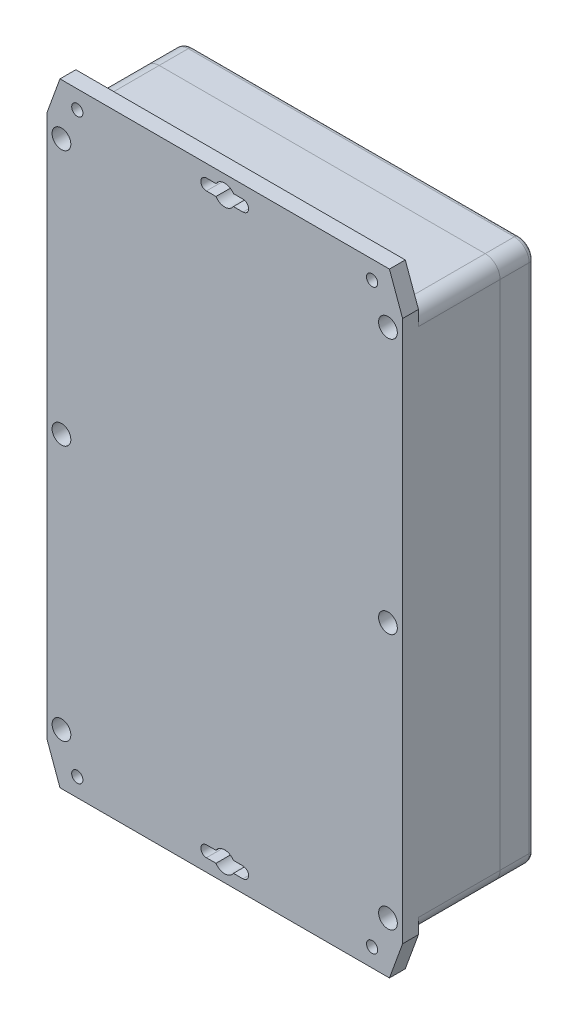
from build123d import *

# Parameters (mm, degrees)
SKETCH2_W               = 146.05
SKETCH2_H               = 251.9934
SKETCH2_R               = 2.2987
BOSS_EXTRUDE1_DEPTH     = 6.5024
CUT_EXTRUDE1_DEPTH      = 146.774141197
BOSS_EXTRUDE2_START     = -33.5026
SKETCH4_W               = 146.05
SKETCH4_H               = 222.25
BOSS_EXTRUDE2_DEPTH     = 33.5026
SKETCH5_R               = 3.8481
CUT_EXTRUDE2_DEPTH      = 24.003
SKETCH6_R               = 2.2225
CUT_EXTRUDE3_DEPTH      = 148.593912628
CUT_EXTRUDE4_DEPTH      = 37.0078
SKETCH9_R               = 3.0099
SKETCH9_R_2             = 1.2446
BOSS_EXTRUDE3_DEPTH     = 7.493
FILLET2_R               = 6.1214
BOSS_EXTRUDE4_DEPTH     = 13.97
CUT_EXTRUDE5_START      = -3.2004
SKETCH12_R              = 3.8481
CUT_EXTRUDE5_DEPTH      = 3.2004
SHELL1_START            = -50.9778
SHELL1_DEPTH            = 10.9728
SHELL1_START_2          = -47.7774
SHELL1_2_DEPTH          = 7.7724
FILLET3_R               = 2.032
SKETCH13_R              = 3.5941
BOSS_EXTRUDE6_DEPTH     = 2.286
BOSS_EXTRUDE6_2_DEPTH   = 2.286
BOSS_EXTRUDE6_3_DEPTH   = 2.286
BOSS_EXTRUDE6_4_DEPTH   = 2.286
BOSS_EXTRUDE6_5_DEPTH   = 2.286
BOSS_EXTRUDE6_6_DEPTH   = 2.286
BOSS_EXTRUDE7_START     = 29.8196
SKETCH14_R              = 2.2225
BOSS_EXTRUDE7_DEPTH     = 29.8196
FILLET4_R               = 1.27
SKETCH15_W              = 1.524
SKETCH15_H              = 222.25
CUT_EXTRUDE_THIN1_DEPTH = 1.524


# Read off the part's stored shape, not the designer's step: Shell1
with BuildPart() as part:
    # Sketch2 → Boss-Extrude1 (new body)
    with BuildSketch(Plane.XY):
        Rectangle(SKETCH2_W, SKETCH2_H)
        with Locations((60.5028, 118.5037)):
            Circle(SKETCH2_R, mode=Mode.SUBTRACT)
        with Locations((-60.5028, 118.5037)):
            Circle(SKETCH2_R, mode=Mode.SUBTRACT)
        with Locations((-60.5028, -118.5037)):
            Circle(SKETCH2_R, mode=Mode.SUBTRACT)
        with Locations((60.5028, -118.5037)):
            Circle(SKETCH2_R, mode=Mode.SUBTRACT)
        with BuildLine():
            Line((-7.5057, -120.8024), (-3.580048681, -120.8024))
            ThreePointArc((-3.580048681, -120.8024), (0, -122.7582), (3.580048681, -120.8024))
            Line((3.580048681, -120.8024), (7.5057, -120.8024))
            ThreePointArc((7.5057, -120.8024), (9.8044, -118.5037), (7.5057, -116.205))
            Line((7.5057, -116.205), (3.580048681, -116.205))
            ThreePointArc((3.580048681, -116.205), (0, -114.2492), (-3.580048681, -116.205))
            Line((-3.580048681, -116.205), (-7.5057, -116.205))
            ThreePointArc((-7.5057, -116.205), (-9.8044, -118.5037), (-7.5057, -120.8024))
        make_face(mode=Mode.SUBTRACT)
        with BuildLine():
            Line((-3.580048681, 120.8024), (-7.5057, 120.8024))
            ThreePointArc((-7.5057, 120.8024), (-9.8044, 118.5037), (-7.5057, 116.205))
            Line((-7.5057, 116.205), (-3.580048681, 116.205))
            ThreePointArc((-3.580048681, 116.205), (0, 114.2492), (3.580048681, 116.205))
            Line((3.580048681, 116.205), (7.5057, 116.205))
            ThreePointArc((7.5057, 116.205), (9.8044, 118.5037), (7.5057, 120.8024))
            Line((7.5057, 120.8024), (3.580048681, 120.8024))
            ThreePointArc((3.580048681, 120.8024), (0, 122.7582), (-3.580048681, 120.8024))
        make_face(mode=Mode.SUBTRACT)
    extrude(amount=-BOSS_EXTRUDE1_DEPTH)

    # Sketch3 → Cut-Extrude1 (cut, through all)
    with BuildSketch(Plane(origin=(0, 0, -6.5024), x_dir=(-1, 0, 0), z_dir=(0, 0, -1))):
        Polygon((73.025, 111.125), (67.612143867, 125.9967), (73.025, 125.9967), align=None)
        Polygon((-73.025, 111.125), (-67.612143867, 125.9967), (-73.025, 125.9967), align=None)
        Polygon((73.025, -111.125), (67.612143867, -125.9967), (73.025, -125.9967), align=None)
        Polygon((-73.025, -111.125), (-67.612143867, -125.9967), (-73.025, -125.9967), align=None)
    extrude(amount=-CUT_EXTRUDE1_DEPTH, mode=Mode.SUBTRACT)

    # Sketch4 → Boss-Extrude2 (add)
    with BuildSketch(Plane.XY.offset(-6.5024).offset(BOSS_EXTRUDE2_START)):
        Rectangle(SKETCH4_W, SKETCH4_H)
    extrude(amount=BOSS_EXTRUDE2_DEPTH)

    # Sketch5 → Cut-Extrude2 (cut)
    with BuildSketch(Plane(origin=(0, 0, 0), x_dir=(-1, 0, 0), z_dir=(0, 0, -1))):
        with Locations((67.0052, 105.0036)):
            Circle(SKETCH5_R)
        with Locations((-67.0052, 105.0036)):
            Circle(SKETCH5_R)
        with Locations((-67.0052, -105.0036)):
            Circle(SKETCH5_R)
        with Locations((67.0052, -105.0036)):
            Circle(SKETCH5_R)
        with Locations((-67.0052, 0)):
            Circle(SKETCH5_R)
        with Locations((67.0052, 0)):
            Circle(SKETCH5_R)
    extrude(amount=CUT_EXTRUDE2_DEPTH, mode=Mode.SUBTRACT)

    # Sketch6 → Cut-Extrude3 (cut, through all)
    with BuildSketch(Plane.XY.offset(-24.003)):
        with Locations((-67.0052, 105.0036)):
            Circle(SKETCH6_R)
        with Locations((67.0052, 105.0036)):
            Circle(SKETCH6_R)
        with Locations((67.0052, -105.0036)):
            Circle(SKETCH6_R)
        with Locations((-67.0052, -105.0036)):
            Circle(SKETCH6_R)
        with Locations((67.0052, 0)):
            Circle(SKETCH6_R)
        with Locations((-67.0052, 0)):
            Circle(SKETCH6_R)
    extrude(amount=-CUT_EXTRUDE3_DEPTH, mode=Mode.SUBTRACT)

    # Sketch8 → Cut-Extrude4 (cut)
    with BuildSketch(Plane(origin=(0, 0, -40.005), x_dir=(-1, 0, 0), z_dir=(0, 0, -1))):
        with BuildLine():
            Line((-67.0052, -6.1214), (-70.485, -6.1214))
            Line((-70.485, -6.1214), (-70.485, -95.4024))
            ThreePointArc((-70.485, -95.4024), (-69.465790177, -97.862990177), (-67.0052, -98.8822))
            Line((-67.0052, -98.8822), (-56.3499, -98.8822))
            ThreePointArc((-56.3499, -98.8822), (-52.919442162, -100.303142162), (-51.4985, -103.7336))
            ThreePointArc((-51.4985, -103.7336), (-50.077557838, -107.164057838), (-46.6471, -108.585))
            Line((-46.6471, -108.585), (46.6471, -108.585))
            ThreePointArc((46.6471, -108.585), (50.077557838, -107.164057838), (51.4985, -103.7336))
            ThreePointArc((51.4985, -103.7336), (52.919442162, -100.303142162), (56.3499, -98.8822))
            Line((56.3499, -98.8822), (67.0052, -98.8822))
            ThreePointArc((67.0052, -98.8822), (69.465790177, -97.862990177), (70.485, -95.4024))
            Line((70.485, -95.4024), (70.485, -6.1214))
            Line((70.485, -6.1214), (67.0052, -6.1214))
            ThreePointArc((67.0052, -6.1214), (60.8838, 0), (67.0052, 6.1214))
            Line((67.0052, 6.1214), (70.485, 6.1214))
            Line((70.485, 6.1214), (70.485, 95.4024))
            ThreePointArc((70.485, 95.4024), (69.465790177, 97.862990177), (67.0052, 98.8822))
            Line((67.0052, 98.8822), (56.3499, 98.8822))
            ThreePointArc((56.3499, 98.8822), (52.919442162, 100.303142162), (51.4985, 103.7336))
            ThreePointArc((51.4985, 103.7336), (50.077557838, 107.164057838), (46.6471, 108.585))
            Line((46.6471, 108.585), (-46.6471, 108.585))
            ThreePointArc((-46.6471, 108.585), (-50.077557838, 107.164057838), (-51.4985, 103.7336))
            ThreePointArc((-51.4985, 103.7336), (-52.919442162, 100.303142162), (-56.3499, 98.8822))
            Line((-56.3499, 98.8822), (-67.0052, 98.8822))
            ThreePointArc((-67.0052, 98.8822), (-69.465790177, 97.862990177), (-70.485, 95.4024))
            Line((-70.485, 95.4024), (-70.485, 6.1214))
            Line((-70.485, 6.1214), (-67.0052, 6.1214))
            ThreePointArc((-67.0052, 6.1214), (-60.8838, 0), (-67.0052, -6.1214))
        make_face()
    extrude(amount=-CUT_EXTRUDE4_DEPTH, mode=Mode.SUBTRACT)

    # Sketch9 → Boss-Extrude3 (add)
    # profile 1 of 8: a face of its own
    with BuildSketch(Plane(origin=(0, 0, 0), x_dir=(-1, 0, 0), z_dir=(0, 0, -1))):
        with Locations(Location((-57.7469, 90.7542, 0), (0, 0, 180))):
            Circle(SKETCH9_R)
        with Locations(Location((-57.7469, 90.7542, 0), (0, 0, 180))):
            Circle(SKETCH9_R_2, mode=Mode.SUBTRACT)
    # profile 2 of 8: a face of its own
    with BuildSketch(Plane(origin=(0, 0, 0), x_dir=(-1, 0, 0), z_dir=(0, 0, -1))):
        with Locations(Location((57.7469, 90.7542, 0), (0, 0, 180))):
            Circle(SKETCH9_R)
        with Locations(Location((57.7469, 90.7542, 0), (0, 0, 180))):
            Circle(SKETCH9_R_2, mode=Mode.SUBTRACT)
    # profile 3 of 8: a face of its own
    with BuildSketch(Plane(origin=(0, 0, 0), x_dir=(-1, 0, 0), z_dir=(0, 0, -1))):
        with Locations(Location((-19.4945, 82.9945, 0), (0, 0, 180))):
            Circle(SKETCH9_R)
        with Locations(Location((-19.4945, 82.9945, 0), (0, 0, 180))):
            Circle(SKETCH9_R_2, mode=Mode.SUBTRACT)
    # profile 4 of 8: a face of its own
    with BuildSketch(Plane(origin=(0, 0, 0), x_dir=(-1, 0, 0), z_dir=(0, 0, -1))):
        with Locations(Location((19.4945, 82.9945, 0), (0, 0, 180))):
            Circle(SKETCH9_R)
        with Locations(Location((19.4945, 82.9945, 0), (0, 0, 180))):
            Circle(SKETCH9_R_2, mode=Mode.SUBTRACT)
    # profile 5 of 8: a face of its own
    with BuildSketch(Plane(origin=(0, 0, 0), x_dir=(-1, 0, 0), z_dir=(0, 0, -1))):
        with Locations(Location((57.7469, -90.7542, 0), (0, 0, 180))):
            Circle(SKETCH9_R)
        with Locations(Location((57.7469, -90.7542, 0), (0, 0, 180))):
            Circle(SKETCH9_R_2, mode=Mode.SUBTRACT)
    # profile 6 of 8: a face of its own
    with BuildSketch(Plane(origin=(0, 0, 0), x_dir=(-1, 0, 0), z_dir=(0, 0, -1))):
        with Locations(Location((-19.4945, -82.9945, 0), (0, 0, 180))):
            Circle(SKETCH9_R)
        with Locations(Location((-19.4945, -82.9945, 0), (0, 0, 180))):
            Circle(SKETCH9_R_2, mode=Mode.SUBTRACT)
    # profile 7 of 8: a face of its own
    with BuildSketch(Plane(origin=(0, 0, 0), x_dir=(-1, 0, 0), z_dir=(0, 0, -1))):
        with Locations(Location((-57.7469, -90.7542, 0), (0, 0, 180))):
            Circle(SKETCH9_R)
        with Locations(Location((-57.7469, -90.7542, 0), (0, 0, 180))):
            Circle(SKETCH9_R_2, mode=Mode.SUBTRACT)
    # profile 8 of 8: a face of its own
    with BuildSketch(Plane(origin=(0, 0, 0), x_dir=(-1, 0, 0), z_dir=(0, 0, -1))):
        with Locations(Location((19.4945, -82.9945, 0), (0, 0, 180))):
            Circle(SKETCH9_R)
        with Locations(Location((19.4945, -82.9945, 0), (0, 0, 180))):
            Circle(SKETCH9_R_2, mode=Mode.SUBTRACT)
    extrude(amount=BOSS_EXTRUDE3_DEPTH)

    # Fillet2
    fillet2_edges = [part.edges().sort_by_distance(p)[0] for p in [
        (-73.025, -111.125, -23.2537),
        (-73.025, 111.125, -23.2537),
        (73.025, 111.125, -23.2537),
        (73.025, -111.125, -23.2537),
    ]]
    fillet(fillet2_edges, radius=FILLET2_R)



with BuildPart() as body_2:
    # Sketch11 → Boss-Extrude4 (new body)
    with BuildSketch(Plane(origin=(0, 0, -40.005), x_dir=(-1, 0, 0), z_dir=(0, 0, -1))):
        with BuildLine():
            Line((-73.025, 105.0036), (-73.025, -105.0036))
            ThreePointArc((-73.025, -105.0036), (-71.23208345, -109.33208345), (-66.9036, -111.125))
            Line((-66.9036, -111.125), (66.9036, -111.125))
            ThreePointArc((66.9036, -111.125), (71.23208345, -109.33208345), (73.025, -105.0036))
            Line((73.025, -105.0036), (73.025, 105.0036))
            ThreePointArc((73.025, 105.0036), (71.23208345, 109.33208345), (66.9036, 111.125))
            Line((66.9036, 111.125), (-66.9036, 111.125))
            ThreePointArc((-66.9036, 111.125), (-71.23208345, 109.33208345), (-73.025, 105.0036))
        make_face()
    extrude(amount=BOSS_EXTRUDE4_DEPTH)

    # Sketch12 → Cut-Extrude5 (cut)
    with BuildSketch(Plane(origin=(0, 0, -53.975), x_dir=(-1, 0, 0), z_dir=(0, 0, -1)).offset(CUT_EXTRUDE5_START)):
        with Locations((-67.0052, 105.0036)):
            Circle(SKETCH12_R)
        with Locations((67.0052, 105.0036)):
            Circle(SKETCH12_R)
        with Locations((67.0052, -105.0036)):
            Circle(SKETCH12_R)
        with Locations((-67.0052, -105.0036)):
            Circle(SKETCH12_R)
        with Locations((-67.0052, 0)):
            Circle(SKETCH12_R)
        with Locations((67.0052, 0)):
            Circle(SKETCH12_R)
    extrude(amount=CUT_EXTRUDE5_DEPTH, mode=Mode.SUBTRACT)

    # Shell1 outline → Shell1 (cut)
    with BuildSketch(Plane.XY.offset(SHELL1_START)):
        with BuildLine():
            Line((-60.914427762, -108.1278), (60.914427762, -108.1278))
            ThreePointArc((60.914427762, -108.1278), (62.124807835, -100.203609958), (70.0278, -98.86177443))
            Line((70.0278, -98.86177443), (70.0278, -6.14182557))
            ThreePointArc((70.0278, -6.14182557), (60.1599, 0), (70.0278, 6.14182557))
            Line((70.0278, 6.14182557), (70.0278, 98.86177443))
            ThreePointArc((70.0278, 98.86177443), (62.124807835, 100.203609958), (60.914427762, 108.1278))
            Line((60.914427762, 108.1278), (-60.914427762, 108.1278))
            ThreePointArc((-60.914427762, 108.1278), (-62.124807835, 100.203609958), (-70.0278, 98.86177443))
            Line((-70.0278, 98.86177443), (-70.0278, 6.14182557))
            ThreePointArc((-70.0278, 6.14182557), (-60.1599, 0), (-70.0278, -6.14182557))
            Line((-70.0278, -6.14182557), (-70.0278, -98.86177443))
            ThreePointArc((-70.0278, -98.86177443), (-62.124807835, -100.203609958), (-60.914427762, -108.1278))
        make_face()
    extrude(amount=SHELL1_DEPTH, mode=Mode.SUBTRACT)

    # Shell1 2 outline → Shell1 2 (cut)
    with BuildSketch(Plane.XY.offset(SHELL1_START_2)):
        with BuildLine():
            Line((60.914427762, -108.1278), (66.9036, -108.1278))
            ThreePointArc((66.9036, -108.1278), (69.112743006, -107.212743006), (70.0278, -105.0036))
            Line((70.0278, -105.0036), (70.0278, -98.86177443))
            ThreePointArc((70.0278, -98.86177443), (62.124807835, -100.203609958), (60.914427762, -108.1278))
        make_face()
        with BuildLine():
            Line((-66.9036, -108.1278), (-60.914427762, -108.1278))
            ThreePointArc((-60.914427762, -108.1278), (-62.124807835, -100.203609958), (-70.0278, -98.86177443))
            Line((-70.0278, -98.86177443), (-70.0278, -105.0036))
            ThreePointArc((-70.0278, -105.0036), (-69.112743006, -107.212743006), (-66.9036, -108.1278))
        make_face()
        with BuildLine():
            ThreePointArc((70.0278, 6.14182557), (60.1599, 0), (70.0278, -6.14182557))
            Line((70.0278, -6.14182557), (70.0278, 6.14182557))
        make_face()
        with BuildLine():
            Line((-70.0278, 6.14182557), (-70.0278, -6.14182557))
            ThreePointArc((-70.0278, -6.14182557), (-60.1599, 0), (-70.0278, 6.14182557))
        make_face()
        with BuildLine():
            ThreePointArc((60.914427762, 108.1278), (62.124807835, 100.203609958), (70.0278, 98.86177443))
            Line((70.0278, 98.86177443), (70.0278, 105.0036))
            ThreePointArc((70.0278, 105.0036), (69.112743006, 107.212743006), (66.9036, 108.1278))
            Line((66.9036, 108.1278), (60.914427762, 108.1278))
        make_face()
        with BuildLine():
            Line((-70.0278, 105.0036), (-70.0278, 98.86177443))
            ThreePointArc((-70.0278, 98.86177443), (-62.124807835, 100.203609958), (-60.914427762, 108.1278))
            Line((-60.914427762, 108.1278), (-66.9036, 108.1278))
            ThreePointArc((-66.9036, 108.1278), (-69.112743006, 107.212743006), (-70.0278, 105.0036))
        make_face()
    extrude(amount=SHELL1_2_DEPTH, mode=Mode.SUBTRACT)

    # Fillet3
    fillet3_edges = [body_2.edges().sort_by_distance(p)[0] for p in [
        (71.23208345, -109.33208345, -53.975),
        (0, -111.125, -53.975),
        (-71.23208345, -109.33208345, -53.975),
        (-73.025, 0, -53.975),
        (-71.23208345, 109.33208345, -53.975),
        (0, 111.125, -53.975),
        (71.23208345, 109.33208345, -53.975),
        (73.025, 0, -53.975),
    ]]
    fillet(fillet3_edges, radius=FILLET3_R)


with BuildPart() as body_3:
    # Sketch13 → Boss-Extrude6 (new body)
    with BuildSketch(Plane(origin=(0, 0, -50.7746), x_dir=(-1, 0, 0), z_dir=(0, 0, -1))):
        with Locations((-67.0052, 0)):
            Circle(SKETCH13_R)
    extrude(amount=BOSS_EXTRUDE6_DEPTH)


with BuildPart() as body_4:
    # Sketch13 → Boss-Extrude6 2 (new body)
    with BuildSketch(Plane(origin=(0, 0, -50.7746), x_dir=(-1, 0, 0), z_dir=(0, 0, -1))):
        with Locations((67.0052, 105.0036)):
            Circle(SKETCH13_R)
    extrude(amount=BOSS_EXTRUDE6_2_DEPTH)


with BuildPart() as body_5:
    # Sketch13 → Boss-Extrude6 3 (new body)
    with BuildSketch(Plane(origin=(0, 0, -50.7746), x_dir=(-1, 0, 0), z_dir=(0, 0, -1))):
        with Locations((-67.0052, 105.0036)):
            Circle(SKETCH13_R)
    extrude(amount=BOSS_EXTRUDE6_3_DEPTH)


with BuildPart() as body_6:
    # Sketch13 → Boss-Extrude6 4 (new body)
    with BuildSketch(Plane(origin=(0, 0, -50.7746), x_dir=(-1, 0, 0), z_dir=(0, 0, -1))):
        with Locations((67.0052, -105.0036)):
            Circle(SKETCH13_R)
    extrude(amount=BOSS_EXTRUDE6_4_DEPTH)


with BuildPart() as body_7:
    # Sketch13 → Boss-Extrude6 5 (new body)
    with BuildSketch(Plane(origin=(0, 0, -50.7746), x_dir=(-1, 0, 0), z_dir=(0, 0, -1))):
        with Locations((-67.0052, -105.0036)):
            Circle(SKETCH13_R)
    extrude(amount=BOSS_EXTRUDE6_5_DEPTH)


with BuildPart() as body_8:
    # Sketch13 → Boss-Extrude6 6 (new body)
    with BuildSketch(Plane(origin=(0, 0, -50.7746), x_dir=(-1, 0, 0), z_dir=(0, 0, -1))):
        with Locations((67.0052, 0)):
            Circle(SKETCH13_R)
    extrude(amount=BOSS_EXTRUDE6_6_DEPTH)


with BuildPart() as part_1:
    add(part.part)

    add(body_4.part)  # Boss-Extrude7 merges body 4

    add(body_6.part)  # Boss-Extrude7 merges body 6

    add(body_7.part)  # Boss-Extrude7 merges body 7

    add(body_5.part)  # Boss-Extrude7 merges body 5

    add(body_3.part)  # Boss-Extrude7 merges body 3

    add(body_8.part)  # Boss-Extrude7 merges body 8
    # Sketch14 → Boss-Extrude7 (add)
    with BuildSketch(Plane.XY.offset(-50.7746).offset(BOSS_EXTRUDE7_START)):
        with Locations(Location((-67.0052, 105.0036, 0), (0, 0, 180))):
            Circle(SKETCH14_R)
        with Locations(Location((-67.0052, -105.0036, 0), (0, 0, 180))):
            Circle(SKETCH14_R)
        with Locations(Location((67.0052, -105.0036, 0), (0, 0, 180))):
            Circle(SKETCH14_R)
        with Locations(Location((67.0052, 105.0036, 0), (0, 0, 180))):
            Circle(SKETCH14_R)
        with Locations(Location((67.0052, 0, 0), (0, 0, 180))):
            Circle(SKETCH14_R)
        with Locations(Location((-67.0052, 0, 0), (0, 0, 180))):
            Circle(SKETCH14_R)
    extrude(amount=-BOSS_EXTRUDE7_DEPTH)

    # Fillet4
    fillet4_edges = [part_1.edges().sort_by_distance(p)[0] for p in [
        (-63.4111, 105.0036, -53.0606),
        (-63.4111, -105.0036, -53.0606),
        (70.5993, -105.0036, -53.0606),
        (70.5993, 105.0036, -53.0606),
        (70.5993, 0, -53.0606),
        (-63.4111, 0, -53.0606),
    ]]
    fillet(fillet4_edges, radius=FILLET4_R)

    # Sketch15 → Cut-Extrude-Thin1 (cut)
    with BuildSketch(Plane(origin=(0, 0, -53.0606), x_dir=(-1, 0, 0), z_dir=(0, 0, -1))):
        with Locations((-67.0052, 0)):
            Rectangle(SKETCH15_W, SKETCH15_H)
    cut_extrude_thin1 = extrude(amount=-CUT_EXTRUDE_THIN1_DEPTH, mode=Mode.SUBTRACT)

    # Mirror1: Cut-Extrude-Thin1 across plane
    add(cut_extrude_thin1.mirror(Plane(origin=(0, 0, 0), x_dir=(0, 0, 1), z_dir=(1, 0, 0))), mode=Mode.SUBTRACT)


with BuildPart() as body_3_2:
    # Sweep1: sweep along a path in Sketch16
    with BuildLine(Plane(origin=(0, 0, -40.005), x_dir=(-1, 0, 0), z_dir=(0, 0, -1))) as sweep1_path:
        Line((46.6471, 108.585), (-46.6471, 108.585))
        ThreePointArc((-46.6471, 108.585), (-50.077557838, 107.164057838), (-51.4985, 103.7336))
        ThreePointArc((-51.4985, 103.7336), (-52.919442162, 100.303142162), (-56.3499, 98.8822))
        Line((-56.3499, 98.8822), (-67.0052, 98.8822))
        ThreePointArc((-67.0052, 98.8822), (-69.465790177, 97.862990177), (-70.485, 95.4024))
        Line((-70.485, 95.4024), (-70.485, -95.4024))
        ThreePointArc((-70.485, -95.4024), (-69.465790177, -97.862990177), (-67.0052, -98.8822))
        Line((-67.0052, -98.8822), (-56.3499, -98.8822))
        ThreePointArc((-56.3499, -98.8822), (-52.919442162, -100.303142162), (-51.4985, -103.7336))
        ThreePointArc((-51.4985, -103.7336), (-50.077557838, -107.164057838), (-46.6471, -108.585))
        Line((-46.6471, -108.585), (46.6471, -108.585))
        ThreePointArc((46.6471, -108.585), (50.077557838, -107.164057838), (51.4985, -103.7336))
        ThreePointArc((51.4985, -103.7336), (52.919442162, -100.303142162), (56.3499, -98.8822))
        Line((56.3499, -98.8822), (67.0052, -98.8822))
        ThreePointArc((67.0052, -98.8822), (69.465790177, -97.862990177), (70.485, -95.4024))
        Line((70.485, -95.4024), (70.485, 95.4024))
        ThreePointArc((70.485, 95.4024), (69.465790177, 97.862990177), (67.0052, 98.8822))
        Line((67.0052, 98.8822), (56.3499, 98.8822))
        ThreePointArc((56.3499, 98.8822), (52.919442162, 100.303142162), (51.4985, 103.7336))
        ThreePointArc((51.4985, 103.7336), (50.077557838, 107.164057838), (46.6471, 108.585))
    # Sketch17 → Sweep1 (sweep)
    with BuildSketch(Plane(origin=(0, 95.4024, 0), x_dir=(-1, 0, 0), z_dir=(0, 1, 0))):
        with BuildLine():
            Line((-71.755, -40.005), (-70.485, -40.005))
            ThreePointArc((-70.485, -40.005), (-71.12, -40.64), (-71.755, -40.005))
        make_face()
    sweep(path=sweep1_path.line)


solid = Compound([body_2.part, part_1.part, body_3_2.part])
